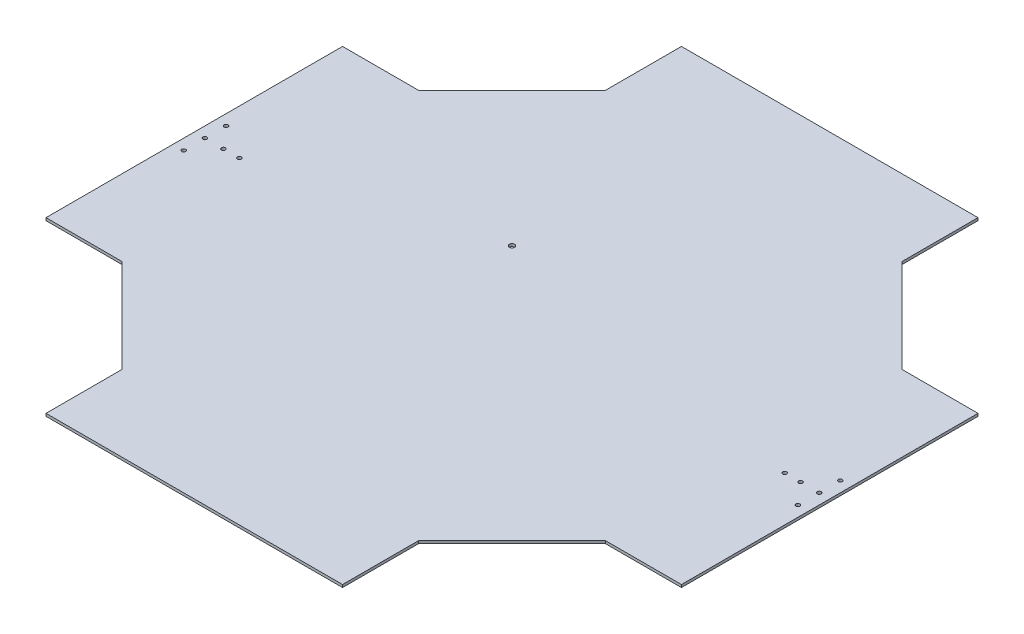
from build123d import *

# Parameters (mm, degrees)
BOSS_EXTRUDE1_DEPTH = 1.5875
SKETCH2_R           = 2.38125
CUT_EXTRUDE1_DEPTH  = 539.824721616
SKETCH3_R           = 3.175
CUT_EXTRUDE2_DEPTH  = 539.824721616


with BuildPart() as part:
    # Sketch1 → Boss-Extrude1 (new, symmetric)
    with BuildSketch(Plane(origin=(0, 0, 0), x_dir=(1, 0, 0), z_dir=(0, 1, 0))):
        Polygon((-381, 177.8), (-289.71875, 177.8), (-177.8, 289.71875), (-177.8, 381), (177.8, 381), (177.8, 289.71875), (289.71875, 177.8), (381, 177.8), (381, -177.8), (289.71875, -177.8), (177.8, -289.71875), (177.8, -381), (-177.8, -381), (-177.8, -289.71875), (-289.71875, -177.8), (-381, -177.8), align=None)
    extrude(amount=BOSS_EXTRUDE1_DEPTH, both=True)

    # Sketch2 → Cut-Extrude1 (cut, through all)
    with BuildSketch(Plane(origin=(0, 1.5875, 0), x_dir=(1, 0, 0), z_dir=(0, 1, 0))):
        with Locations((-346.075, 0)):
            Circle(SKETCH2_R)
        with Locations((-368.3, 0)):
            Circle(SKETCH2_R)
        with Locations((-368.3, 25.4)):
            Circle(SKETCH2_R)
        with Locations((-368.3, -25.4)):
            Circle(SKETCH2_R)
        with Locations((368.3, -25.4)):
            Circle(SKETCH2_R)
        with Locations((368.3, 25.4)):
            Circle(SKETCH2_R)
        with Locations((368.3, 0)):
            Circle(SKETCH2_R)
        with Locations((346.075, 0)):
            Circle(SKETCH2_R)
        with Locations((-327.025, 0)):
            Circle(SKETCH2_R)
        with Locations((327.025, 0)):
            Circle(SKETCH2_R)
    extrude(amount=-CUT_EXTRUDE1_DEPTH, mode=Mode.SUBTRACT)

    # Sketch3 → Cut-Extrude2 (cut, through all)
    with BuildSketch(Plane(origin=(0, 1.5875, 0), x_dir=(1, 0, 0), z_dir=(0, 1, 0))):
        with Locations((-72.39, 72.39)):
            Circle(SKETCH3_R)
    extrude(amount=-CUT_EXTRUDE2_DEPTH, mode=Mode.SUBTRACT)


solid = part.part
